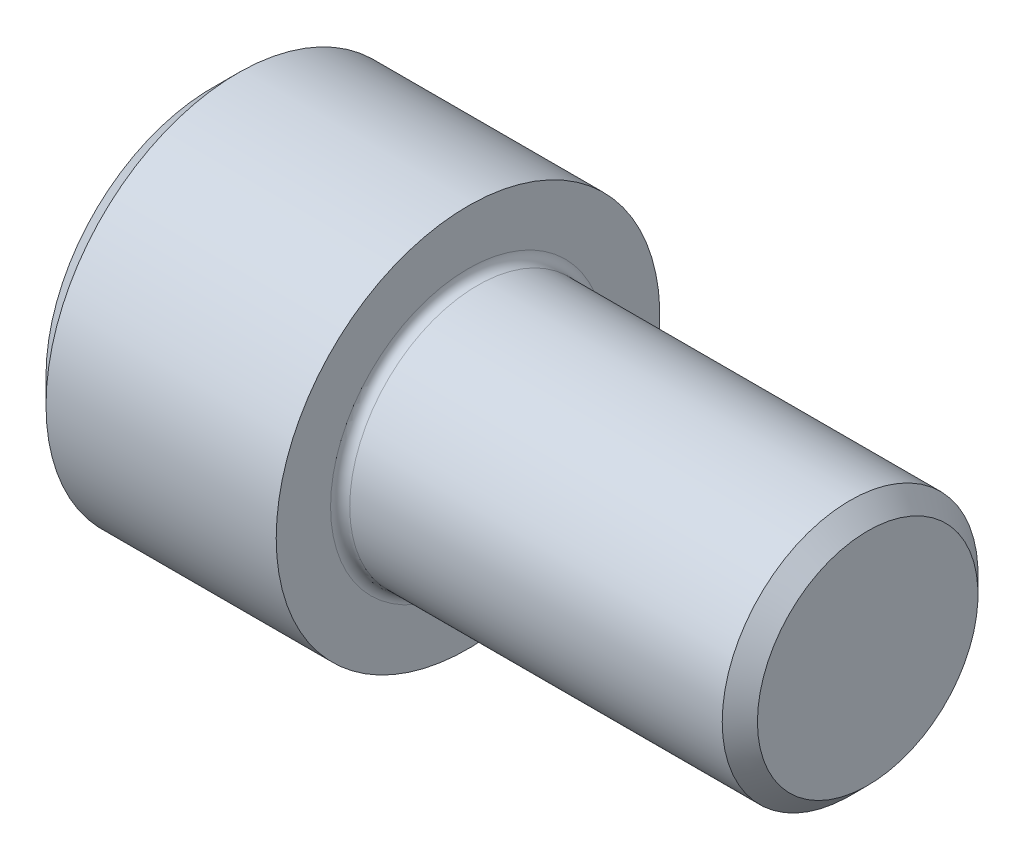
from build123d import *

# Parameters (mm, degrees)
FILLET1_R   = 0.6
HEX_2_DEPTH = 8


with BuildPart() as part:
    # BodySke → Base-Revolve (revolve)
    with BuildSketch(Plane.XY):
        Polygon((0, 0), (0, 10.4), (1.6, 12), (16, 12), (16, 8), (39.8985, 8), (41, 6.8985), (41, 0), align=None)
    revolve(axis=Axis((-31.75, 0, 0), (1, 0, 0)))

    # Fillet1
    fillet1_edges = [part.edges().sort_by_distance(p)[0] for p in [
        (16, -8, 0),
    ]]
    fillet(fillet1_edges, radius=FILLET1_R)

    # Sketch2 → Hex-PreBroach (revolve, cut)
    with BuildSketch(Plane.XY):
        Polygon((0, 7.071), (8, 7.071), (12.082443753, 0), (0, 0), align=None)
    revolve(axis=Axis((0, 0, 0), (1, 0, 0)), mode=Mode.SUBTRACT)

    # Sketch3 → Hex 2 (cut)
    with BuildSketch(Plane(origin=(0, 0, 0), x_dir=(0, 0.500000000000001, 0.866025403784438), z_dir=(-1, 0, 0))):
        Polygon((4.082443753, 7.071), (-4.082443753, 7.071), (-8.164887507, 0), (-4.082443753, -7.071), (4.082443753, -7.071), (8.164887507, 0), align=None)
    extrude(amount=-HEX_2_DEPTH, mode=Mode.SUBTRACT)


solid = part.part
